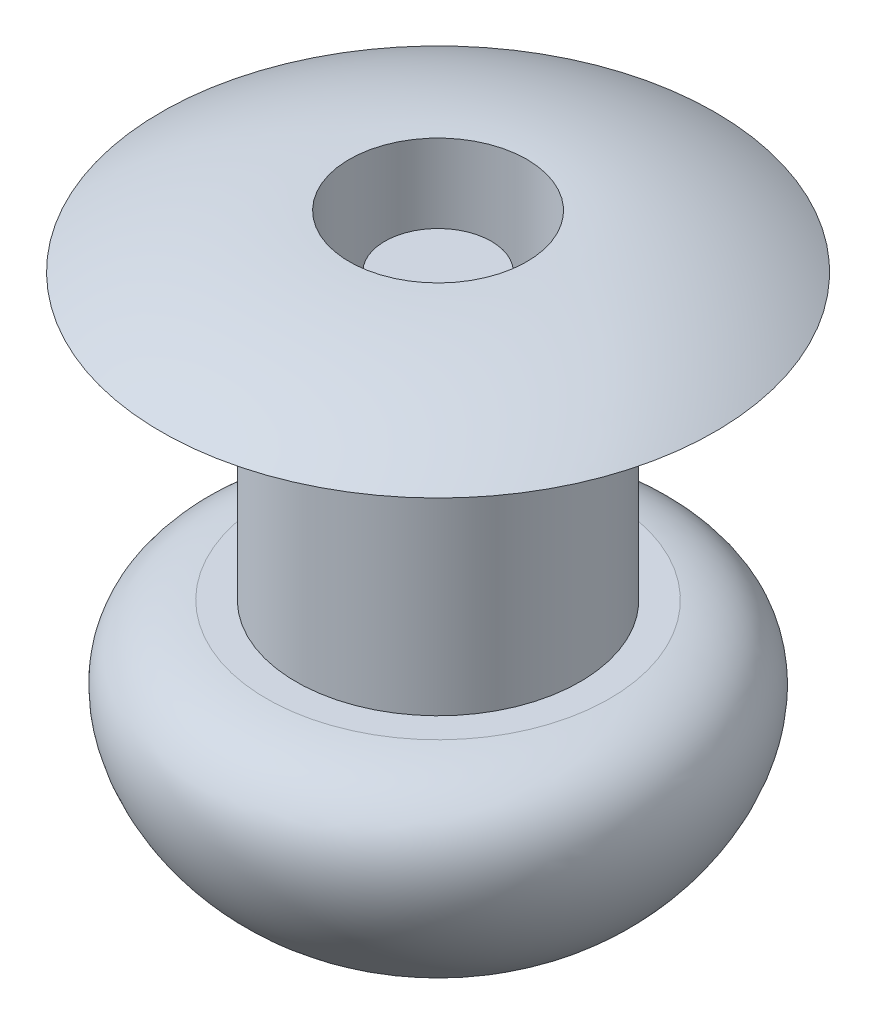
from build123d import *


with BuildPart() as part:
    # Szkic1 → Obrót1 (revolve)
    with BuildSketch(Plane(origin=(0, 0, 0), x_dir=(0, 0, -1), z_dir=(1, 0, 0))):
        with BuildLine():
            Line((0, 0), (0, -4.000000003))
            Line((0, -4.000000003), (0, -5.500000003))
            add(Edge.make_bspline(
                [(-0.956030427, -5.378190673), (-0.520263876, -5.500000003), (0, -5.500000003)],
                knots=[0.992852221, 0.992852221, 0.992852221, 1.570796327, 1.570796327, 1.570796327], degree=2, weights=[1, 0.958537313, 1]))
            add(Edge.make_bspline(
                [(-2.413891755, -4.000000003), (-3.858559437, -4.163296689), (-3.558358928, -6.322980365), (-0.971318098, -7.871940019), (-0.341145137, -5.792031912), (-0.956030427, -5.378190673)],
                knots=[0, 0, 0, 0, 0.454219308, 0.705200672, 1, 1, 1, 1], degree=3))
            Line((-2.413891755, -4.000000003), (-2, -4.000000003))
            Line((-2, -4.000000003), (-2, 0))
            Line((-2, 0), (-3.9, 0))
            ThreePointArc((-3.9, 0), (-2.627043935, 0.558888572), (-1.25, 0.75))
            Line((-1.25, 0.75), (-1.25, -4.000000003))
            Line((-1.25, -4.000000003), (-0.75, -4.000000003))
            Line((-0.75, -4.000000003), (-0.75, 0))
            Line((-0.75, 0), (0, 0))
        make_face()
    revolve(axis=Axis((0, 0, 0), (0, 1, 0)))


solid = part.part
